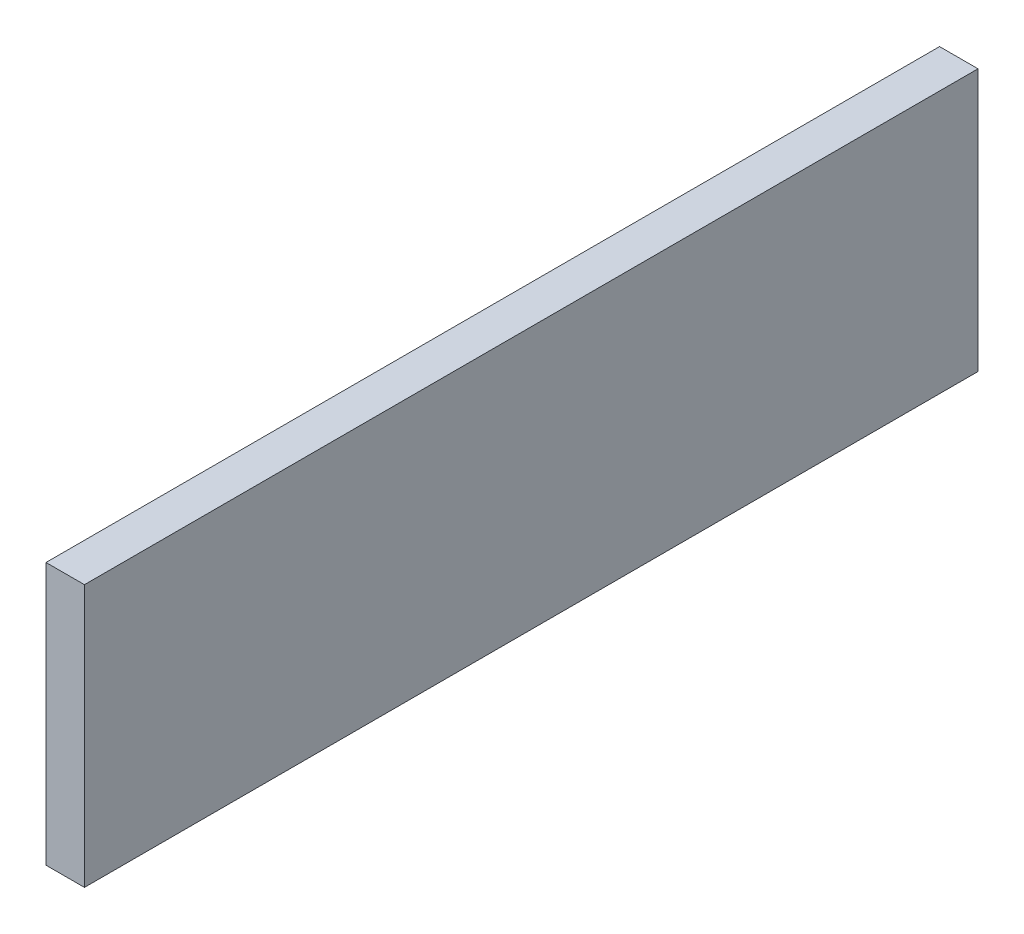
from build123d import *

# Parameters (mm, degrees)
ESBO_O1_W                = 11
ESBO_O1_H                = 75
RESSALTO_EXTRUS_O1_DEPTH = 255.6


with BuildPart() as part:
    # Esboço1 → Ressalto-extrusão1 (new body)
    with BuildSketch(Plane.XY):
        Rectangle(ESBO_O1_W, ESBO_O1_H)
    extrude(amount=RESSALTO_EXTRUS_O1_DEPTH)


solid = part.part
